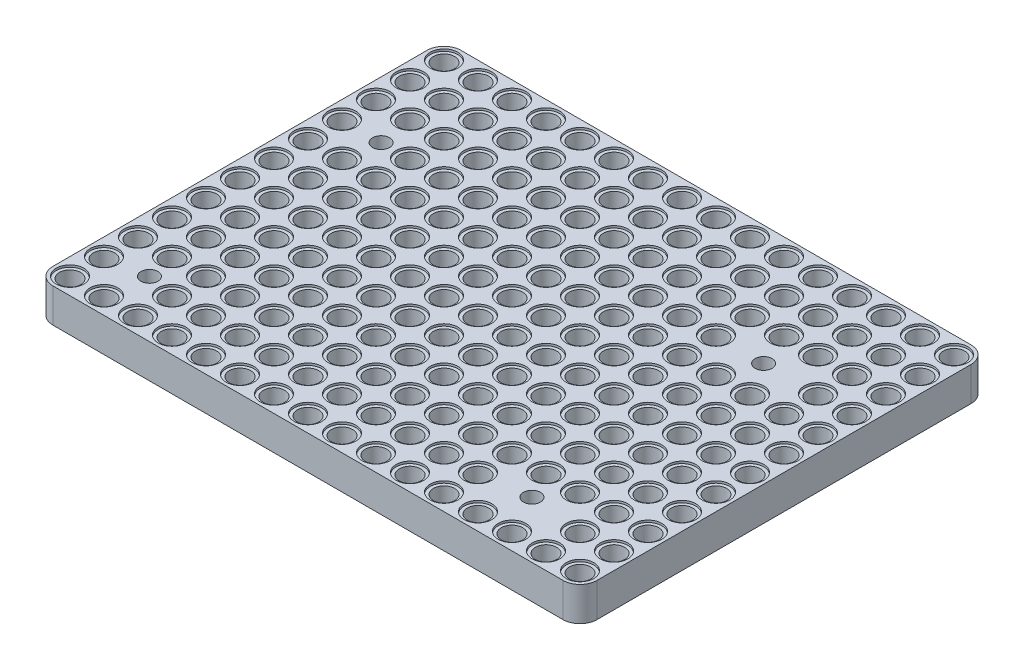
from build123d import *

# Parameters (mm, degrees)
SKETCH_1_R          = 2.5
SKETCH_1_R_2        = 2
EXTRUDE_1_DEPTH     = 8
SKETCH_2_R          = 3.25
CUT_EXTRUDE_1_DEPTH = 0.5
CUT_EXTRUDE_START   = -0.5
SKETCH_3_R          = 3.25
CUT_EXTRUDE_2_DEPTH = 0.5


with BuildPart() as part:
    # Эскиз1 → Бобышка-Вытянуть1 (new body)
    with BuildSketch(Plane(origin=(0, 0, 0), x_dir=(1, 0, 0), z_dir=(0, 1, 0))):
        with BuildLine():
            Line((-9.4, -13.3), (110.6, -13.3))
            ThreePointArc((110.6, -13.3), (113.428427125, -12.128427125), (114.6, -9.3))
            Line((114.6, -9.3), (114.6, 78.7))
            ThreePointArc((114.6, 78.7), (113.428427125, 81.528427125), (110.6, 82.7))
            Line((110.6, 82.7), (-9.4, 82.7))
            ThreePointArc((-9.4, 82.7), (-12.228427125, 81.528427125), (-13.4, 78.7))
            Line((-13.4, 78.7), (-13.4, -9.3))
            ThreePointArc((-13.4, -9.3), (-12.228427125, -12.128427125), (-9.4, -13.3))
        make_face()
        with Locations(Location((-9.4, 78.7, 0), (0, 0, 270))):
            Circle(SKETCH_1_R, mode=Mode.SUBTRACT)
        with Locations(Location((-1.4, 78.7, 0), (0, 0, 270))):
            Circle(SKETCH_1_R, mode=Mode.SUBTRACT)
        with Locations(Location((6.6, 78.7, 0), (0, 0, 270))):
            Circle(SKETCH_1_R, mode=Mode.SUBTRACT)
        with Locations(Location((14.6, 78.7, 0), (0, 0, 270))):
            Circle(SKETCH_1_R, mode=Mode.SUBTRACT)
        with Locations(Location((22.6, 78.7, 0), (0, 0, 270))):
            Circle(SKETCH_1_R, mode=Mode.SUBTRACT)
        with Locations(Location((30.6, 78.7, 0), (0, 0, 270))):
            Circle(SKETCH_1_R, mode=Mode.SUBTRACT)
        with Locations(Location((38.6, 78.7, 0), (0, 0, 270))):
            Circle(SKETCH_1_R, mode=Mode.SUBTRACT)
        with Locations(Location((46.6, 78.7, 0), (0, 0, 270))):
            Circle(SKETCH_1_R, mode=Mode.SUBTRACT)
        with Locations(Location((54.6, 78.7, 0), (0, 0, 270))):
            Circle(SKETCH_1_R, mode=Mode.SUBTRACT)
        with Locations(Location((62.6, 78.7, 0), (0, 0, 270))):
            Circle(SKETCH_1_R, mode=Mode.SUBTRACT)
        with Locations(Location((70.6, 78.7, 0), (0, 0, 270))):
            Circle(SKETCH_1_R, mode=Mode.SUBTRACT)
        with Locations(Location((78.6, 78.7, 0), (0, 0, 270))):
            Circle(SKETCH_1_R, mode=Mode.SUBTRACT)
        with Locations(Location((86.6, 78.7, 0), (0, 0, 270))):
            Circle(SKETCH_1_R, mode=Mode.SUBTRACT)
        with Locations(Location((94.6, 78.7, 0), (0, 0, 270))):
            Circle(SKETCH_1_R, mode=Mode.SUBTRACT)
        with Locations(Location((102.6, 78.7, 0), (0, 0, 270))):
            Circle(SKETCH_1_R, mode=Mode.SUBTRACT)
        with Locations(Location((110.6, 78.7, 0), (0, 0, 270))):
            Circle(SKETCH_1_R, mode=Mode.SUBTRACT)
        with Locations(Location((-1.4, 70.7, 0), (0, 0, 270))):
            Circle(SKETCH_1_R, mode=Mode.SUBTRACT)
        with Locations(Location((6.6, 70.7, 0), (0, 0, 270))):
            Circle(SKETCH_1_R, mode=Mode.SUBTRACT)
        with Locations(Location((14.6, 70.7, 0), (0, 0, 270))):
            Circle(SKETCH_1_R, mode=Mode.SUBTRACT)
        with Locations(Location((22.6, 70.7, 0), (0, 0, 270))):
            Circle(SKETCH_1_R, mode=Mode.SUBTRACT)
        with Locations(Location((30.6, 70.7, 0), (0, 0, 270))):
            Circle(SKETCH_1_R, mode=Mode.SUBTRACT)
        with Locations(Location((38.6, 70.7, 0), (0, 0, 270))):
            Circle(SKETCH_1_R, mode=Mode.SUBTRACT)
        with Locations(Location((46.6, 70.7, 0), (0, 0, 270))):
            Circle(SKETCH_1_R, mode=Mode.SUBTRACT)
        with Locations(Location((54.6, 70.7, 0), (0, 0, 270))):
            Circle(SKETCH_1_R, mode=Mode.SUBTRACT)
        with Locations(Location((62.6, 70.7, 0), (0, 0, 270))):
            Circle(SKETCH_1_R, mode=Mode.SUBTRACT)
        with Locations(Location((70.6, 70.7, 0), (0, 0, 270))):
            Circle(SKETCH_1_R, mode=Mode.SUBTRACT)
        with Locations(Location((78.6, 70.7, 0), (0, 0, 270))):
            Circle(SKETCH_1_R, mode=Mode.SUBTRACT)
        with Locations(Location((86.6, 70.7, 0), (0, 0, 270))):
            Circle(SKETCH_1_R, mode=Mode.SUBTRACT)
        with Locations(Location((94.6, 70.7, 0), (0, 0, 270))):
            Circle(SKETCH_1_R, mode=Mode.SUBTRACT)
        with Locations(Location((102.6, 70.7, 0), (0, 0, 270))):
            Circle(SKETCH_1_R, mode=Mode.SUBTRACT)
        with Locations(Location((110.6, 70.7, 0), (0, 0, 270))):
            Circle(SKETCH_1_R, mode=Mode.SUBTRACT)
        with Locations(Location((-1.4, 62.7, 0), (0, 0, 270))):
            Circle(SKETCH_1_R, mode=Mode.SUBTRACT)
        with Locations(Location((6.6, 62.7, 0), (0, 0, 270))):
            Circle(SKETCH_1_R, mode=Mode.SUBTRACT)
        with Locations(Location((14.6, 62.7, 0), (0, 0, 270))):
            Circle(SKETCH_1_R, mode=Mode.SUBTRACT)
        with Locations(Location((22.6, 62.7, 0), (0, 0, 270))):
            Circle(SKETCH_1_R, mode=Mode.SUBTRACT)
        with Locations(Location((30.6, 62.7, 0), (0, 0, 270))):
            Circle(SKETCH_1_R, mode=Mode.SUBTRACT)
        with Locations(Location((38.6, 62.7, 0), (0, 0, 270))):
            Circle(SKETCH_1_R, mode=Mode.SUBTRACT)
        with Locations(Location((46.6, 62.7, 0), (0, 0, 270))):
            Circle(SKETCH_1_R, mode=Mode.SUBTRACT)
        with Locations(Location((54.6, 62.7, 0), (0, 0, 270))):
            Circle(SKETCH_1_R, mode=Mode.SUBTRACT)
        with Locations(Location((62.6, 62.7, 0), (0, 0, 270))):
            Circle(SKETCH_1_R, mode=Mode.SUBTRACT)
        with Locations(Location((70.6, 62.7, 0), (0, 0, 270))):
            Circle(SKETCH_1_R, mode=Mode.SUBTRACT)
        with Locations(Location((78.6, 62.7, 0), (0, 0, 270))):
            Circle(SKETCH_1_R, mode=Mode.SUBTRACT)
        with Locations(Location((86.6, 62.7, 0), (0, 0, 270))):
            Circle(SKETCH_1_R, mode=Mode.SUBTRACT)
        with Locations(Location((94.6, 62.7, 0), (0, 0, 270))):
            Circle(SKETCH_1_R, mode=Mode.SUBTRACT)
        with Locations(Location((102.6, 62.7, 0), (0, 0, 270))):
            Circle(SKETCH_1_R, mode=Mode.SUBTRACT)
        with Locations(Location((110.6, 62.7, 0), (0, 0, 270))):
            Circle(SKETCH_1_R, mode=Mode.SUBTRACT)
        with Locations(Location((6.6, 54.7, 0), (0, 0, 270))):
            Circle(SKETCH_1_R, mode=Mode.SUBTRACT)
        with Locations(Location((14.6, 54.7, 0), (0, 0, 270))):
            Circle(SKETCH_1_R, mode=Mode.SUBTRACT)
        with Locations(Location((22.6, 54.7, 0), (0, 0, 270))):
            Circle(SKETCH_1_R, mode=Mode.SUBTRACT)
        with Locations(Location((30.6, 54.7, 0), (0, 0, 270))):
            Circle(SKETCH_1_R, mode=Mode.SUBTRACT)
        with Locations(Location((38.6, 54.7, 0), (0, 0, 270))):
            Circle(SKETCH_1_R, mode=Mode.SUBTRACT)
        with Locations(Location((46.6, 54.7, 0), (0, 0, 270))):
            Circle(SKETCH_1_R, mode=Mode.SUBTRACT)
        with Locations(Location((54.6, 54.7, 0), (0, 0, 270))):
            Circle(SKETCH_1_R, mode=Mode.SUBTRACT)
        with Locations(Location((62.6, 54.7, 0), (0, 0, 270))):
            Circle(SKETCH_1_R, mode=Mode.SUBTRACT)
        with Locations(Location((70.6, 54.7, 0), (0, 0, 270))):
            Circle(SKETCH_1_R, mode=Mode.SUBTRACT)
        with Locations(Location((78.6, 54.7, 0), (0, 0, 270))):
            Circle(SKETCH_1_R, mode=Mode.SUBTRACT)
        with Locations(Location((102.6, 54.7, 0), (0, 0, 270))):
            Circle(SKETCH_1_R, mode=Mode.SUBTRACT)
        with Locations(Location((110.6, 54.7, 0), (0, 0, 270))):
            Circle(SKETCH_1_R, mode=Mode.SUBTRACT)
        with Locations(Location((-1.4, 46.7, 0), (0, 0, 270))):
            Circle(SKETCH_1_R, mode=Mode.SUBTRACT)
        with Locations(Location((6.6, 46.7, 0), (0, 0, 270))):
            Circle(SKETCH_1_R, mode=Mode.SUBTRACT)
        with Locations(Location((14.6, 46.7, 0), (0, 0, 270))):
            Circle(SKETCH_1_R, mode=Mode.SUBTRACT)
        with Locations(Location((22.6, 46.7, 0), (0, 0, 270))):
            Circle(SKETCH_1_R, mode=Mode.SUBTRACT)
        with Locations(Location((30.6, 46.7, 0), (0, 0, 270))):
            Circle(SKETCH_1_R, mode=Mode.SUBTRACT)
        with Locations(Location((38.6, 46.7, 0), (0, 0, 270))):
            Circle(SKETCH_1_R, mode=Mode.SUBTRACT)
        with Locations(Location((46.6, 46.7, 0), (0, 0, 270))):
            Circle(SKETCH_1_R, mode=Mode.SUBTRACT)
        with Locations(Location((54.6, 46.7, 0), (0, 0, 270))):
            Circle(SKETCH_1_R, mode=Mode.SUBTRACT)
        with Locations(Location((62.6, 46.7, 0), (0, 0, 270))):
            Circle(SKETCH_1_R, mode=Mode.SUBTRACT)
        with Locations(Location((70.6, 46.7, 0), (0, 0, 270))):
            Circle(SKETCH_1_R, mode=Mode.SUBTRACT)
        with Locations(Location((78.6, 46.7, 0), (0, 0, 270))):
            Circle(SKETCH_1_R, mode=Mode.SUBTRACT)
        with Locations(Location((86.6, 46.7, 0), (0, 0, 270))):
            Circle(SKETCH_1_R, mode=Mode.SUBTRACT)
        with Locations(Location((94.6, 46.7, 0), (0, 0, 270))):
            Circle(SKETCH_1_R, mode=Mode.SUBTRACT)
        with Locations(Location((102.6, 46.7, 0), (0, 0, 270))):
            Circle(SKETCH_1_R, mode=Mode.SUBTRACT)
        with Locations(Location((110.6, 46.7, 0), (0, 0, 270))):
            Circle(SKETCH_1_R, mode=Mode.SUBTRACT)
        with Locations(Location((-1.4, 38.7, 0), (0, 0, 270))):
            Circle(SKETCH_1_R, mode=Mode.SUBTRACT)
        with Locations(Location((6.6, 38.7, 0), (0, 0, 270))):
            Circle(SKETCH_1_R, mode=Mode.SUBTRACT)
        with Locations(Location((14.6, 38.7, 0), (0, 0, 270))):
            Circle(SKETCH_1_R, mode=Mode.SUBTRACT)
        with Locations(Location((22.6, 38.7, 0), (0, 0, 270))):
            Circle(SKETCH_1_R, mode=Mode.SUBTRACT)
        with Locations(Location((30.6, 38.7, 0), (0, 0, 270))):
            Circle(SKETCH_1_R, mode=Mode.SUBTRACT)
        with Locations(Location((38.6, 38.7, 0), (0, 0, 270))):
            Circle(SKETCH_1_R, mode=Mode.SUBTRACT)
        with Locations(Location((46.6, 38.7, 0), (0, 0, 270))):
            Circle(SKETCH_1_R, mode=Mode.SUBTRACT)
        with Locations(Location((54.6, 38.7, 0), (0, 0, 270))):
            Circle(SKETCH_1_R, mode=Mode.SUBTRACT)
        with Locations(Location((62.6, 38.7, 0), (0, 0, 270))):
            Circle(SKETCH_1_R, mode=Mode.SUBTRACT)
        with Locations(Location((70.6, 38.7, 0), (0, 0, 270))):
            Circle(SKETCH_1_R, mode=Mode.SUBTRACT)
        with Locations(Location((78.6, 38.7, 0), (0, 0, 270))):
            Circle(SKETCH_1_R, mode=Mode.SUBTRACT)
        with Locations(Location((86.6, 38.7, 0), (0, 0, 270))):
            Circle(SKETCH_1_R, mode=Mode.SUBTRACT)
        with Locations(Location((94.6, 38.7, 0), (0, 0, 270))):
            Circle(SKETCH_1_R, mode=Mode.SUBTRACT)
        with Locations(Location((102.6, 38.7, 0), (0, 0, 270))):
            Circle(SKETCH_1_R, mode=Mode.SUBTRACT)
        with Locations(Location((110.6, 38.7, 0), (0, 0, 270))):
            Circle(SKETCH_1_R, mode=Mode.SUBTRACT)
        with Locations(Location((-1.4, 30.7, 0), (0, 0, 270))):
            Circle(SKETCH_1_R, mode=Mode.SUBTRACT)
        with Locations(Location((6.6, 30.7, 0), (0, 0, 270))):
            Circle(SKETCH_1_R, mode=Mode.SUBTRACT)
        with Locations(Location((14.6, 30.7, 0), (0, 0, 270))):
            Circle(SKETCH_1_R, mode=Mode.SUBTRACT)
        with Locations(Location((22.6, 30.7, 0), (0, 0, 270))):
            Circle(SKETCH_1_R, mode=Mode.SUBTRACT)
        with Locations(Location((30.6, 30.7, 0), (0, 0, 270))):
            Circle(SKETCH_1_R, mode=Mode.SUBTRACT)
        with Locations(Location((38.6, 30.7, 0), (0, 0, 270))):
            Circle(SKETCH_1_R, mode=Mode.SUBTRACT)
        with Locations(Location((46.6, 30.7, 0), (0, 0, 270))):
            Circle(SKETCH_1_R, mode=Mode.SUBTRACT)
        with Locations(Location((54.6, 30.7, 0), (0, 0, 270))):
            Circle(SKETCH_1_R, mode=Mode.SUBTRACT)
        with Locations(Location((62.6, 30.7, 0), (0, 0, 270))):
            Circle(SKETCH_1_R, mode=Mode.SUBTRACT)
        with Locations(Location((70.6, 30.7, 0), (0, 0, 270))):
            Circle(SKETCH_1_R, mode=Mode.SUBTRACT)
        with Locations(Location((78.6, 30.7, 0), (0, 0, 270))):
            Circle(SKETCH_1_R, mode=Mode.SUBTRACT)
        with Locations(Location((86.6, 30.7, 0), (0, 0, 270))):
            Circle(SKETCH_1_R, mode=Mode.SUBTRACT)
        with Locations(Location((94.6, 30.7, 0), (0, 0, 270))):
            Circle(SKETCH_1_R, mode=Mode.SUBTRACT)
        with Locations(Location((102.6, 30.7, 0), (0, 0, 270))):
            Circle(SKETCH_1_R, mode=Mode.SUBTRACT)
        with Locations(Location((110.6, 30.7, 0), (0, 0, 270))):
            Circle(SKETCH_1_R, mode=Mode.SUBTRACT)
        with Locations(Location((-1.4, 22.7, 0), (0, 0, 270))):
            Circle(SKETCH_1_R, mode=Mode.SUBTRACT)
        with Locations(Location((6.6, 22.7, 0), (0, 0, 270))):
            Circle(SKETCH_1_R, mode=Mode.SUBTRACT)
        with Locations(Location((14.6, 22.7, 0), (0, 0, 270))):
            Circle(SKETCH_1_R, mode=Mode.SUBTRACT)
        with Locations(Location((22.6, 22.7, 0), (0, 0, 270))):
            Circle(SKETCH_1_R, mode=Mode.SUBTRACT)
        with Locations(Location((30.6, 22.7, 0), (0, 0, 270))):
            Circle(SKETCH_1_R, mode=Mode.SUBTRACT)
        with Locations(Location((38.6, 22.7, 0), (0, 0, 270))):
            Circle(SKETCH_1_R, mode=Mode.SUBTRACT)
        with Locations(Location((46.6, 22.7, 0), (0, 0, 270))):
            Circle(SKETCH_1_R, mode=Mode.SUBTRACT)
        with Locations(Location((54.6, 22.7, 0), (0, 0, 270))):
            Circle(SKETCH_1_R, mode=Mode.SUBTRACT)
        with Locations(Location((62.6, 22.7, 0), (0, 0, 270))):
            Circle(SKETCH_1_R, mode=Mode.SUBTRACT)
        with Locations(Location((70.6, 22.7, 0), (0, 0, 270))):
            Circle(SKETCH_1_R, mode=Mode.SUBTRACT)
        with Locations(Location((78.6, 22.7, 0), (0, 0, 270))):
            Circle(SKETCH_1_R, mode=Mode.SUBTRACT)
        with Locations(Location((86.6, 22.7, 0), (0, 0, 270))):
            Circle(SKETCH_1_R, mode=Mode.SUBTRACT)
        with Locations(Location((94.6, 22.7, 0), (0, 0, 270))):
            Circle(SKETCH_1_R, mode=Mode.SUBTRACT)
        with Locations(Location((102.6, 22.7, 0), (0, 0, 270))):
            Circle(SKETCH_1_R, mode=Mode.SUBTRACT)
        with Locations(Location((110.6, 22.7, 0), (0, 0, 270))):
            Circle(SKETCH_1_R, mode=Mode.SUBTRACT)
        with Locations(Location((-1.4, 14.7, 0), (0, 0, 270))):
            Circle(SKETCH_1_R, mode=Mode.SUBTRACT)
        with Locations(Location((6.6, 14.7, 0), (0, 0, 270))):
            Circle(SKETCH_1_R, mode=Mode.SUBTRACT)
        with Locations(Location((14.6, 14.7, 0), (0, 0, 270))):
            Circle(SKETCH_1_R, mode=Mode.SUBTRACT)
        with Locations(Location((22.6, 14.7, 0), (0, 0, 270))):
            Circle(SKETCH_1_R, mode=Mode.SUBTRACT)
        with Locations(Location((30.6, 14.7, 0), (0, 0, 270))):
            Circle(SKETCH_1_R, mode=Mode.SUBTRACT)
        with Locations(Location((38.6, 14.7, 0), (0, 0, 270))):
            Circle(SKETCH_1_R, mode=Mode.SUBTRACT)
        with Locations(Location((46.6, 14.7, 0), (0, 0, 270))):
            Circle(SKETCH_1_R, mode=Mode.SUBTRACT)
        with Locations(Location((54.6, 14.7, 0), (0, 0, 270))):
            Circle(SKETCH_1_R, mode=Mode.SUBTRACT)
        with Locations(Location((62.6, 14.7, 0), (0, 0, 270))):
            Circle(SKETCH_1_R, mode=Mode.SUBTRACT)
        with Locations(Location((70.6, 14.7, 0), (0, 0, 270))):
            Circle(SKETCH_1_R, mode=Mode.SUBTRACT)
        with Locations(Location((78.6, 14.7, 0), (0, 0, 270))):
            Circle(SKETCH_1_R, mode=Mode.SUBTRACT)
        with Locations(Location((86.6, 14.7, 0), (0, 0, 270))):
            Circle(SKETCH_1_R, mode=Mode.SUBTRACT)
        with Locations(Location((94.6, 14.7, 0), (0, 0, 270))):
            Circle(SKETCH_1_R, mode=Mode.SUBTRACT)
        with Locations(Location((102.6, 14.7, 0), (0, 0, 270))):
            Circle(SKETCH_1_R, mode=Mode.SUBTRACT)
        with Locations(Location((110.6, 14.7, 0), (0, 0, 270))):
            Circle(SKETCH_1_R, mode=Mode.SUBTRACT)
        with Locations(Location((-1.4, 6.7, 0), (0, 0, 270))):
            Circle(SKETCH_1_R, mode=Mode.SUBTRACT)
        with Locations(Location((6.6, 6.7, 0), (0, 0, 270))):
            Circle(SKETCH_1_R, mode=Mode.SUBTRACT)
        with Locations(Location((14.6, 6.7, 0), (0, 0, 270))):
            Circle(SKETCH_1_R, mode=Mode.SUBTRACT)
        with Locations(Location((22.6, 6.7, 0), (0, 0, 270))):
            Circle(SKETCH_1_R, mode=Mode.SUBTRACT)
        with Locations(Location((30.6, 6.7, 0), (0, 0, 270))):
            Circle(SKETCH_1_R, mode=Mode.SUBTRACT)
        with Locations(Location((38.6, 6.7, 0), (0, 0, 270))):
            Circle(SKETCH_1_R, mode=Mode.SUBTRACT)
        with Locations(Location((46.6, 6.7, 0), (0, 0, 270))):
            Circle(SKETCH_1_R, mode=Mode.SUBTRACT)
        with Locations(Location((54.6, 6.7, 0), (0, 0, 270))):
            Circle(SKETCH_1_R, mode=Mode.SUBTRACT)
        with Locations(Location((62.6, 6.7, 0), (0, 0, 270))):
            Circle(SKETCH_1_R, mode=Mode.SUBTRACT)
        with Locations(Location((70.6, 6.7, 0), (0, 0, 270))):
            Circle(SKETCH_1_R, mode=Mode.SUBTRACT)
        with Locations(Location((78.6, 6.7, 0), (0, 0, 270))):
            Circle(SKETCH_1_R, mode=Mode.SUBTRACT)
        with Locations(Location((86.6, 6.7, 0), (0, 0, 270))):
            Circle(SKETCH_1_R, mode=Mode.SUBTRACT)
        with Locations(Location((94.6, 6.7, 0), (0, 0, 270))):
            Circle(SKETCH_1_R, mode=Mode.SUBTRACT)
        with Locations(Location((102.6, 6.7, 0), (0, 0, 270))):
            Circle(SKETCH_1_R, mode=Mode.SUBTRACT)
        with Locations(Location((110.6, 6.7, 0), (0, 0, 270))):
            Circle(SKETCH_1_R, mode=Mode.SUBTRACT)
        with Locations(Location((6.6, -1.3, 0), (0, 0, 270))):
            Circle(SKETCH_1_R, mode=Mode.SUBTRACT)
        with Locations(Location((14.6, -1.3, 0), (0, 0, 270))):
            Circle(SKETCH_1_R, mode=Mode.SUBTRACT)
        with Locations(Location((22.6, -1.3, 0), (0, 0, 270))):
            Circle(SKETCH_1_R, mode=Mode.SUBTRACT)
        with Locations(Location((30.6, -1.3, 0), (0, 0, 270))):
            Circle(SKETCH_1_R, mode=Mode.SUBTRACT)
        with Locations(Location((38.6, -1.3, 0), (0, 0, 270))):
            Circle(SKETCH_1_R, mode=Mode.SUBTRACT)
        with Locations(Location((46.6, -1.3, 0), (0, 0, 270))):
            Circle(SKETCH_1_R, mode=Mode.SUBTRACT)
        with Locations(Location((54.6, -1.3, 0), (0, 0, 270))):
            Circle(SKETCH_1_R, mode=Mode.SUBTRACT)
        with Locations(Location((62.6, -1.3, 0), (0, 0, 270))):
            Circle(SKETCH_1_R, mode=Mode.SUBTRACT)
        with Locations(Location((70.6, -1.3, 0), (0, 0, 270))):
            Circle(SKETCH_1_R, mode=Mode.SUBTRACT)
        with Locations(Location((78.6, -1.3, 0), (0, 0, 270))):
            Circle(SKETCH_1_R, mode=Mode.SUBTRACT)
        with Locations(Location((102.6, -1.3, 0), (0, 0, 270))):
            Circle(SKETCH_1_R, mode=Mode.SUBTRACT)
        with Locations(Location((110.6, -1.3, 0), (0, 0, 270))):
            Circle(SKETCH_1_R, mode=Mode.SUBTRACT)
        with Locations(Location((-1.4, -9.3, 0), (0, 0, 270))):
            Circle(SKETCH_1_R, mode=Mode.SUBTRACT)
        with Locations(Location((6.6, -9.3, 0), (0, 0, 270))):
            Circle(SKETCH_1_R, mode=Mode.SUBTRACT)
        with Locations(Location((14.6, -9.3, 0), (0, 0, 270))):
            Circle(SKETCH_1_R, mode=Mode.SUBTRACT)
        with Locations(Location((22.6, -9.3, 0), (0, 0, 270))):
            Circle(SKETCH_1_R, mode=Mode.SUBTRACT)
        with Locations(Location((30.6, -9.3, 0), (0, 0, 270))):
            Circle(SKETCH_1_R, mode=Mode.SUBTRACT)
        with Locations(Location((38.6, -9.3, 0), (0, 0, 270))):
            Circle(SKETCH_1_R, mode=Mode.SUBTRACT)
        with Locations(Location((46.6, -9.3, 0), (0, 0, 270))):
            Circle(SKETCH_1_R, mode=Mode.SUBTRACT)
        with Locations(Location((54.6, -9.3, 0), (0, 0, 270))):
            Circle(SKETCH_1_R, mode=Mode.SUBTRACT)
        with Locations(Location((62.6, -9.3, 0), (0, 0, 270))):
            Circle(SKETCH_1_R, mode=Mode.SUBTRACT)
        with Locations(Location((70.6, -9.3, 0), (0, 0, 270))):
            Circle(SKETCH_1_R, mode=Mode.SUBTRACT)
        with Locations(Location((78.6, -9.3, 0), (0, 0, 270))):
            Circle(SKETCH_1_R, mode=Mode.SUBTRACT)
        with Locations(Location((86.6, -9.3, 0), (0, 0, 270))):
            Circle(SKETCH_1_R, mode=Mode.SUBTRACT)
        with Locations(Location((94.6, -9.3, 0), (0, 0, 270))):
            Circle(SKETCH_1_R, mode=Mode.SUBTRACT)
        with Locations(Location((102.6, -9.3, 0), (0, 0, 270))):
            Circle(SKETCH_1_R, mode=Mode.SUBTRACT)
        with Locations(Location((110.6, -9.3, 0), (0, 0, 270))):
            Circle(SKETCH_1_R, mode=Mode.SUBTRACT)
        with Locations(Location((-9.4, 70.7, 0), (0, 0, 270))):
            Circle(SKETCH_1_R, mode=Mode.SUBTRACT)
        with Locations(Location((-9.4, 62.7, 0), (0, 0, 270))):
            Circle(SKETCH_1_R, mode=Mode.SUBTRACT)
        with Locations(Location((-9.4, 54.7, 0), (0, 0, 270))):
            Circle(SKETCH_1_R, mode=Mode.SUBTRACT)
        with Locations(Location((-9.4, 46.7, 0), (0, 0, 270))):
            Circle(SKETCH_1_R, mode=Mode.SUBTRACT)
        with Locations(Location((-9.4, 38.7, 0), (0, 0, 270))):
            Circle(SKETCH_1_R, mode=Mode.SUBTRACT)
        with Locations(Location((-9.4, 30.7, 0), (0, 0, 270))):
            Circle(SKETCH_1_R, mode=Mode.SUBTRACT)
        with Locations(Location((-9.4, 22.7, 0), (0, 0, 270))):
            Circle(SKETCH_1_R, mode=Mode.SUBTRACT)
        with Locations(Location((-9.4, 14.7, 0), (0, 0, 270))):
            Circle(SKETCH_1_R, mode=Mode.SUBTRACT)
        with Locations(Location((-9.4, 6.7, 0), (0, 0, 270))):
            Circle(SKETCH_1_R, mode=Mode.SUBTRACT)
        with Locations(Location((-9.4, -1.3, 0), (0, 0, 270))):
            Circle(SKETCH_1_R, mode=Mode.SUBTRACT)
        with Locations(Location((-9.4, -9.3, 0), (0, 0, 270))):
            Circle(SKETCH_1_R, mode=Mode.SUBTRACT)
        with Locations(Location((0, 54.5, 0), (0, 0, 270))):
            Circle(SKETCH_1_R_2, mode=Mode.SUBTRACT)
        with Locations(Location((90, 54.5, 0), (0, 0, 270))):
            Circle(SKETCH_1_R_2, mode=Mode.SUBTRACT)
        with Locations(Location((90, 0, 0), (0, 0, 270))):
            Circle(SKETCH_1_R_2, mode=Mode.SUBTRACT)
        with Locations(Location((0, 0, 0), (0, 0, 270))):
            Circle(SKETCH_1_R_2, mode=Mode.SUBTRACT)
    extrude(amount=EXTRUDE_1_DEPTH)

    # Эскиз2 → Вырез-Вытянуть1 (cut)
    with BuildSketch(Plane(origin=(0, 8, 0), x_dir=(1, 0, 0), z_dir=(0, 1, 0))):
        with Locations(Location((-9.4, 78.7, 0), (0, 0, 270))):
            Circle(SKETCH_2_R)
        with Locations(Location((-1.4, 78.7, 0), (0, 0, 270))):
            Circle(SKETCH_2_R)
        with Locations(Location((6.6, 78.7, 0), (0, 0, 270))):
            Circle(SKETCH_2_R)
        with Locations(Location((14.6, 78.7, 0), (0, 0, 270))):
            Circle(SKETCH_2_R)
        with Locations(Location((22.6, 78.7, 0), (0, 0, 270))):
            Circle(SKETCH_2_R)
        with Locations(Location((30.6, 78.7, 0), (0, 0, 270))):
            Circle(SKETCH_2_R)
        with Locations(Location((38.6, 78.7, 0), (0, 0, 270))):
            Circle(SKETCH_2_R)
        with Locations(Location((46.6, 78.7, 0), (0, 0, 270))):
            Circle(SKETCH_2_R)
        with Locations(Location((54.6, 78.7, 0), (0, 0, 270))):
            Circle(SKETCH_2_R)
        with Locations(Location((62.6, 78.7, 0), (0, 0, 270))):
            Circle(SKETCH_2_R)
        with Locations(Location((70.6, 78.7, 0), (0, 0, 270))):
            Circle(SKETCH_2_R)
        with Locations(Location((78.6, 78.7, 0), (0, 0, 270))):
            Circle(SKETCH_2_R)
        with Locations(Location((86.6, 78.7, 0), (0, 0, 270))):
            Circle(SKETCH_2_R)
        with Locations(Location((94.6, 78.7, 0), (0, 0, 270))):
            Circle(SKETCH_2_R)
        with Locations(Location((102.6, 78.7, 0), (0, 0, 270))):
            Circle(SKETCH_2_R)
        with Locations(Location((110.6, 78.7, 0), (0, 0, 270))):
            Circle(SKETCH_2_R)
        with Locations(Location((-1.4, 70.7, 0), (0, 0, 270))):
            Circle(SKETCH_2_R)
        with Locations(Location((6.6, 70.7, 0), (0, 0, 270))):
            Circle(SKETCH_2_R)
        with Locations(Location((14.6, 70.7, 0), (0, 0, 270))):
            Circle(SKETCH_2_R)
        with Locations(Location((22.6, 70.7, 0), (0, 0, 270))):
            Circle(SKETCH_2_R)
        with Locations(Location((30.6, 70.7, 0), (0, 0, 270))):
            Circle(SKETCH_2_R)
        with Locations(Location((38.6, 70.7, 0), (0, 0, 270))):
            Circle(SKETCH_2_R)
        with Locations(Location((46.6, 70.7, 0), (0, 0, 270))):
            Circle(SKETCH_2_R)
        with Locations(Location((54.6, 70.7, 0), (0, 0, 270))):
            Circle(SKETCH_2_R)
        with Locations(Location((62.6, 70.7, 0), (0, 0, 270))):
            Circle(SKETCH_2_R)
        with Locations(Location((70.6, 70.7, 0), (0, 0, 270))):
            Circle(SKETCH_2_R)
        with Locations(Location((78.6, 70.7, 0), (0, 0, 270))):
            Circle(SKETCH_2_R)
        with Locations(Location((86.6, 70.7, 0), (0, 0, 270))):
            Circle(SKETCH_2_R)
        with Locations(Location((94.6, 70.7, 0), (0, 0, 270))):
            Circle(SKETCH_2_R)
        with Locations(Location((102.6, 70.7, 0), (0, 0, 270))):
            Circle(SKETCH_2_R)
        with Locations(Location((110.6, 70.7, 0), (0, 0, 270))):
            Circle(SKETCH_2_R)
        with Locations(Location((-1.4, 62.7, 0), (0, 0, 270))):
            Circle(SKETCH_2_R)
        with Locations(Location((6.6, 62.7, 0), (0, 0, 270))):
            Circle(SKETCH_2_R)
        with Locations(Location((14.6, 62.7, 0), (0, 0, 270))):
            Circle(SKETCH_2_R)
        with Locations(Location((22.6, 62.7, 0), (0, 0, 270))):
            Circle(SKETCH_2_R)
        with Locations(Location((30.6, 62.7, 0), (0, 0, 270))):
            Circle(SKETCH_2_R)
        with Locations(Location((38.6, 62.7, 0), (0, 0, 270))):
            Circle(SKETCH_2_R)
        with Locations(Location((46.6, 62.7, 0), (0, 0, 270))):
            Circle(SKETCH_2_R)
        with Locations(Location((54.6, 62.7, 0), (0, 0, 270))):
            Circle(SKETCH_2_R)
        with Locations(Location((62.6, 62.7, 0), (0, 0, 270))):
            Circle(SKETCH_2_R)
        with Locations(Location((70.6, 62.7, 0), (0, 0, 270))):
            Circle(SKETCH_2_R)
        with Locations(Location((78.6, 62.7, 0), (0, 0, 270))):
            Circle(SKETCH_2_R)
        with Locations(Location((86.6, 62.7, 0), (0, 0, 270))):
            Circle(SKETCH_2_R)
        with Locations(Location((94.6, 62.7, 0), (0, 0, 270))):
            Circle(SKETCH_2_R)
        with Locations(Location((102.6, 62.7, 0), (0, 0, 270))):
            Circle(SKETCH_2_R)
        with Locations(Location((110.6, 62.7, 0), (0, 0, 270))):
            Circle(SKETCH_2_R)
        with Locations(Location((6.6, 54.7, 0), (0, 0, 270))):
            Circle(SKETCH_2_R)
        with Locations(Location((14.6, 54.7, 0), (0, 0, 270))):
            Circle(SKETCH_2_R)
        with Locations(Location((22.6, 54.7, 0), (0, 0, 270))):
            Circle(SKETCH_2_R)
        with Locations(Location((30.6, 54.7, 0), (0, 0, 270))):
            Circle(SKETCH_2_R)
        with Locations(Location((38.6, 54.7, 0), (0, 0, 270))):
            Circle(SKETCH_2_R)
        with Locations(Location((46.6, 54.7, 0), (0, 0, 270))):
            Circle(SKETCH_2_R)
        with Locations(Location((54.6, 54.7, 0), (0, 0, 270))):
            Circle(SKETCH_2_R)
        with Locations(Location((62.6, 54.7, 0), (0, 0, 270))):
            Circle(SKETCH_2_R)
        with Locations(Location((70.6, 54.7, 0), (0, 0, 270))):
            Circle(SKETCH_2_R)
        with Locations(Location((78.6, 54.7, 0), (0, 0, 270))):
            Circle(SKETCH_2_R)
        with Locations(Location((102.6, 54.7, 0), (0, 0, 270))):
            Circle(SKETCH_2_R)
        with Locations(Location((110.6, 54.7, 0), (0, 0, 270))):
            Circle(SKETCH_2_R)
        with Locations(Location((-1.4, 46.7, 0), (0, 0, 270))):
            Circle(SKETCH_2_R)
        with Locations(Location((6.6, 46.7, 0), (0, 0, 270))):
            Circle(SKETCH_2_R)
        with Locations(Location((14.6, 46.7, 0), (0, 0, 270))):
            Circle(SKETCH_2_R)
        with Locations(Location((22.6, 46.7, 0), (0, 0, 270))):
            Circle(SKETCH_2_R)
        with Locations(Location((30.6, 46.7, 0), (0, 0, 270))):
            Circle(SKETCH_2_R)
        with Locations(Location((38.6, 46.7, 0), (0, 0, 270))):
            Circle(SKETCH_2_R)
        with Locations(Location((46.6, 46.7, 0), (0, 0, 270))):
            Circle(SKETCH_2_R)
        with Locations(Location((54.6, 46.7, 0), (0, 0, 270))):
            Circle(SKETCH_2_R)
        with Locations(Location((62.6, 46.7, 0), (0, 0, 270))):
            Circle(SKETCH_2_R)
        with Locations(Location((70.6, 46.7, 0), (0, 0, 270))):
            Circle(SKETCH_2_R)
        with Locations(Location((78.6, 46.7, 0), (0, 0, 270))):
            Circle(SKETCH_2_R)
        with Locations(Location((86.6, 46.7, 0), (0, 0, 270))):
            Circle(SKETCH_2_R)
        with Locations(Location((94.6, 46.7, 0), (0, 0, 270))):
            Circle(SKETCH_2_R)
        with Locations(Location((102.6, 46.7, 0), (0, 0, 270))):
            Circle(SKETCH_2_R)
        with Locations(Location((110.6, 46.7, 0), (0, 0, 270))):
            Circle(SKETCH_2_R)
        with Locations(Location((-1.4, 38.7, 0), (0, 0, 270))):
            Circle(SKETCH_2_R)
        with Locations(Location((6.6, 38.7, 0), (0, 0, 270))):
            Circle(SKETCH_2_R)
        with Locations(Location((14.6, 38.7, 0), (0, 0, 270))):
            Circle(SKETCH_2_R)
        with Locations(Location((22.6, 38.7, 0), (0, 0, 270))):
            Circle(SKETCH_2_R)
        with Locations(Location((30.6, 38.7, 0), (0, 0, 270))):
            Circle(SKETCH_2_R)
        with Locations(Location((38.6, 38.7, 0), (0, 0, 270))):
            Circle(SKETCH_2_R)
        with Locations(Location((46.6, 38.7, 0), (0, 0, 270))):
            Circle(SKETCH_2_R)
        with Locations(Location((54.6, 38.7, 0), (0, 0, 270))):
            Circle(SKETCH_2_R)
        with Locations(Location((62.6, 38.7, 0), (0, 0, 270))):
            Circle(SKETCH_2_R)
        with Locations(Location((70.6, 38.7, 0), (0, 0, 270))):
            Circle(SKETCH_2_R)
        with Locations(Location((78.6, 38.7, 0), (0, 0, 270))):
            Circle(SKETCH_2_R)
        with Locations(Location((86.6, 38.7, 0), (0, 0, 270))):
            Circle(SKETCH_2_R)
        with Locations(Location((94.6, 38.7, 0), (0, 0, 270))):
            Circle(SKETCH_2_R)
        with Locations(Location((102.6, 38.7, 0), (0, 0, 270))):
            Circle(SKETCH_2_R)
        with Locations(Location((110.6, 38.7, 0), (0, 0, 270))):
            Circle(SKETCH_2_R)
        with Locations(Location((-1.4, 30.7, 0), (0, 0, 270))):
            Circle(SKETCH_2_R)
        with Locations(Location((6.6, 30.7, 0), (0, 0, 270))):
            Circle(SKETCH_2_R)
        with Locations(Location((14.6, 30.7, 0), (0, 0, 270))):
            Circle(SKETCH_2_R)
        with Locations(Location((22.6, 30.7, 0), (0, 0, 270))):
            Circle(SKETCH_2_R)
        with Locations(Location((30.6, 30.7, 0), (0, 0, 270))):
            Circle(SKETCH_2_R)
        with Locations(Location((38.6, 30.7, 0), (0, 0, 270))):
            Circle(SKETCH_2_R)
        with Locations(Location((46.6, 30.7, 0), (0, 0, 270))):
            Circle(SKETCH_2_R)
        with Locations(Location((54.6, 30.7, 0), (0, 0, 270))):
            Circle(SKETCH_2_R)
        with Locations(Location((62.6, 30.7, 0), (0, 0, 270))):
            Circle(SKETCH_2_R)
        with Locations(Location((70.6, 30.7, 0), (0, 0, 270))):
            Circle(SKETCH_2_R)
        with Locations(Location((78.6, 30.7, 0), (0, 0, 270))):
            Circle(SKETCH_2_R)
        with Locations(Location((86.6, 30.7, 0), (0, 0, 270))):
            Circle(SKETCH_2_R)
        with Locations(Location((94.6, 30.7, 0), (0, 0, 270))):
            Circle(SKETCH_2_R)
        with Locations(Location((102.6, 30.7, 0), (0, 0, 270))):
            Circle(SKETCH_2_R)
        with Locations(Location((110.6, 30.7, 0), (0, 0, 270))):
            Circle(SKETCH_2_R)
        with Locations(Location((-1.4, 22.7, 0), (0, 0, 270))):
            Circle(SKETCH_2_R)
        with Locations(Location((6.6, 22.7, 0), (0, 0, 270))):
            Circle(SKETCH_2_R)
        with Locations(Location((14.6, 22.7, 0), (0, 0, 270))):
            Circle(SKETCH_2_R)
        with Locations(Location((22.6, 22.7, 0), (0, 0, 270))):
            Circle(SKETCH_2_R)
        with Locations(Location((30.6, 22.7, 0), (0, 0, 270))):
            Circle(SKETCH_2_R)
        with Locations(Location((38.6, 22.7, 0), (0, 0, 270))):
            Circle(SKETCH_2_R)
        with Locations(Location((46.6, 22.7, 0), (0, 0, 270))):
            Circle(SKETCH_2_R)
        with Locations(Location((54.6, 22.7, 0), (0, 0, 270))):
            Circle(SKETCH_2_R)
        with Locations(Location((62.6, 22.7, 0), (0, 0, 270))):
            Circle(SKETCH_2_R)
        with Locations(Location((70.6, 22.7, 0), (0, 0, 270))):
            Circle(SKETCH_2_R)
        with Locations(Location((78.6, 22.7, 0), (0, 0, 270))):
            Circle(SKETCH_2_R)
        with Locations(Location((86.6, 22.7, 0), (0, 0, 270))):
            Circle(SKETCH_2_R)
        with Locations(Location((94.6, 22.7, 0), (0, 0, 270))):
            Circle(SKETCH_2_R)
        with Locations(Location((102.6, 22.7, 0), (0, 0, 270))):
            Circle(SKETCH_2_R)
        with Locations(Location((110.6, 22.7, 0), (0, 0, 270))):
            Circle(SKETCH_2_R)
        with Locations(Location((-1.4, 14.7, 0), (0, 0, 270))):
            Circle(SKETCH_2_R)
        with Locations(Location((6.6, 14.7, 0), (0, 0, 270))):
            Circle(SKETCH_2_R)
        with Locations(Location((14.6, 14.7, 0), (0, 0, 270))):
            Circle(SKETCH_2_R)
        with Locations(Location((22.6, 14.7, 0), (0, 0, 270))):
            Circle(SKETCH_2_R)
        with Locations(Location((30.6, 14.7, 0), (0, 0, 270))):
            Circle(SKETCH_2_R)
        with Locations(Location((38.6, 14.7, 0), (0, 0, 270))):
            Circle(SKETCH_2_R)
        with Locations(Location((46.6, 14.7, 0), (0, 0, 270))):
            Circle(SKETCH_2_R)
        with Locations(Location((54.6, 14.7, 0), (0, 0, 270))):
            Circle(SKETCH_2_R)
        with Locations(Location((62.6, 14.7, 0), (0, 0, 270))):
            Circle(SKETCH_2_R)
        with Locations(Location((70.6, 14.7, 0), (0, 0, 270))):
            Circle(SKETCH_2_R)
        with Locations(Location((78.6, 14.7, 0), (0, 0, 270))):
            Circle(SKETCH_2_R)
        with Locations(Location((86.6, 14.7, 0), (0, 0, 270))):
            Circle(SKETCH_2_R)
        with Locations(Location((94.6, 14.7, 0), (0, 0, 270))):
            Circle(SKETCH_2_R)
        with Locations(Location((102.6, 14.7, 0), (0, 0, 270))):
            Circle(SKETCH_2_R)
        with Locations(Location((110.6, 14.7, 0), (0, 0, 270))):
            Circle(SKETCH_2_R)
        with Locations(Location((-1.4, 6.7, 0), (0, 0, 270))):
            Circle(SKETCH_2_R)
        with Locations(Location((6.6, 6.7, 0), (0, 0, 270))):
            Circle(SKETCH_2_R)
        with Locations(Location((14.6, 6.7, 0), (0, 0, 270))):
            Circle(SKETCH_2_R)
        with Locations(Location((22.6, 6.7, 0), (0, 0, 270))):
            Circle(SKETCH_2_R)
        with Locations(Location((30.6, 6.7, 0), (0, 0, 270))):
            Circle(SKETCH_2_R)
        with Locations(Location((38.6, 6.7, 0), (0, 0, 270))):
            Circle(SKETCH_2_R)
        with Locations(Location((46.6, 6.7, 0), (0, 0, 270))):
            Circle(SKETCH_2_R)
        with Locations(Location((54.6, 6.7, 0), (0, 0, 270))):
            Circle(SKETCH_2_R)
        with Locations(Location((62.6, 6.7, 0), (0, 0, 270))):
            Circle(SKETCH_2_R)
        with Locations(Location((70.6, 6.7, 0), (0, 0, 270))):
            Circle(SKETCH_2_R)
        with Locations(Location((78.6, 6.7, 0), (0, 0, 270))):
            Circle(SKETCH_2_R)
        with Locations(Location((86.6, 6.7, 0), (0, 0, 270))):
            Circle(SKETCH_2_R)
        with Locations(Location((94.6, 6.7, 0), (0, 0, 270))):
            Circle(SKETCH_2_R)
        with Locations(Location((102.6, 6.7, 0), (0, 0, 270))):
            Circle(SKETCH_2_R)
        with Locations(Location((110.6, 6.7, 0), (0, 0, 270))):
            Circle(SKETCH_2_R)
        with Locations(Location((6.6, -1.3, 0), (0, 0, 270))):
            Circle(SKETCH_2_R)
        with Locations(Location((14.6, -1.3, 0), (0, 0, 270))):
            Circle(SKETCH_2_R)
        with Locations(Location((22.6, -1.3, 0), (0, 0, 270))):
            Circle(SKETCH_2_R)
        with Locations(Location((30.6, -1.3, 0), (0, 0, 270))):
            Circle(SKETCH_2_R)
        with Locations(Location((38.6, -1.3, 0), (0, 0, 270))):
            Circle(SKETCH_2_R)
        with Locations(Location((46.6, -1.3, 0), (0, 0, 270))):
            Circle(SKETCH_2_R)
        with Locations(Location((54.6, -1.3, 0), (0, 0, 270))):
            Circle(SKETCH_2_R)
        with Locations(Location((62.6, -1.3, 0), (0, 0, 270))):
            Circle(SKETCH_2_R)
        with Locations(Location((70.6, -1.3, 0), (0, 0, 270))):
            Circle(SKETCH_2_R)
        with Locations(Location((78.6, -1.3, 0), (0, 0, 270))):
            Circle(SKETCH_2_R)
        with Locations(Location((102.6, -1.3, 0), (0, 0, 270))):
            Circle(SKETCH_2_R)
        with Locations(Location((110.6, -1.3, 0), (0, 0, 270))):
            Circle(SKETCH_2_R)
        with Locations(Location((-1.4, -9.3, 0), (0, 0, 270))):
            Circle(SKETCH_2_R)
        with Locations(Location((6.6, -9.3, 0), (0, 0, 270))):
            Circle(SKETCH_2_R)
        with Locations(Location((14.6, -9.3, 0), (0, 0, 270))):
            Circle(SKETCH_2_R)
        with Locations(Location((22.6, -9.3, 0), (0, 0, 270))):
            Circle(SKETCH_2_R)
        with Locations(Location((30.6, -9.3, 0), (0, 0, 270))):
            Circle(SKETCH_2_R)
        with Locations(Location((38.6, -9.3, 0), (0, 0, 270))):
            Circle(SKETCH_2_R)
        with Locations(Location((46.6, -9.3, 0), (0, 0, 270))):
            Circle(SKETCH_2_R)
        with Locations(Location((54.6, -9.3, 0), (0, 0, 270))):
            Circle(SKETCH_2_R)
        with Locations(Location((62.6, -9.3, 0), (0, 0, 270))):
            Circle(SKETCH_2_R)
        with Locations(Location((70.6, -9.3, 0), (0, 0, 270))):
            Circle(SKETCH_2_R)
        with Locations(Location((78.6, -9.3, 0), (0, 0, 270))):
            Circle(SKETCH_2_R)
        with Locations(Location((86.6, -9.3, 0), (0, 0, 270))):
            Circle(SKETCH_2_R)
        with Locations(Location((94.6, -9.3, 0), (0, 0, 270))):
            Circle(SKETCH_2_R)
        with Locations(Location((102.6, -9.3, 0), (0, 0, 270))):
            Circle(SKETCH_2_R)
        with Locations(Location((110.6, -9.3, 0), (0, 0, 270))):
            Circle(SKETCH_2_R)
        with Locations(Location((-9.4, 70.7, 0), (0, 0, 270))):
            Circle(SKETCH_2_R)
        with Locations(Location((-9.4, 62.7, 0), (0, 0, 270))):
            Circle(SKETCH_2_R)
        with Locations(Location((-9.4, 54.7, 0), (0, 0, 270))):
            Circle(SKETCH_2_R)
        with Locations(Location((-9.4, 46.7, 0), (0, 0, 270))):
            Circle(SKETCH_2_R)
        with Locations(Location((-9.4, 38.7, 0), (0, 0, 270))):
            Circle(SKETCH_2_R)
        with Locations(Location((-9.4, 30.7, 0), (0, 0, 270))):
            Circle(SKETCH_2_R)
        with Locations(Location((-9.4, 22.7, 0), (0, 0, 270))):
            Circle(SKETCH_2_R)
        with Locations(Location((-9.4, 14.7, 0), (0, 0, 270))):
            Circle(SKETCH_2_R)
        with Locations(Location((-9.4, 6.7, 0), (0, 0, 270))):
            Circle(SKETCH_2_R)
        with Locations(Location((-9.4, -1.3, 0), (0, 0, 270))):
            Circle(SKETCH_2_R)
        with Locations(Location((-9.4, -9.3, 0), (0, 0, 270))):
            Circle(SKETCH_2_R)
    extrude(amount=-CUT_EXTRUDE_1_DEPTH, mode=Mode.SUBTRACT)

    # Эскиз3 → Вырез-Вытянуть2 (cut)
    with BuildSketch(Plane.XZ.offset(CUT_EXTRUDE_START)):
        with Locations(Location((-9.4, -78.7, 0), (0, 0, 90))):
            Circle(SKETCH_3_R)
        with Locations(Location((-1.4, -78.7, 0), (0, 0, 90))):
            Circle(SKETCH_3_R)
        with Locations(Location((6.6, -78.7, 0), (0, 0, 90))):
            Circle(SKETCH_3_R)
        with Locations(Location((14.6, -78.7, 0), (0, 0, 90))):
            Circle(SKETCH_3_R)
        with Locations(Location((22.6, -78.7, 0), (0, 0, 90))):
            Circle(SKETCH_3_R)
        with Locations(Location((30.6, -78.7, 0), (0, 0, 90))):
            Circle(SKETCH_3_R)
        with Locations(Location((38.6, -78.7, 0), (0, 0, 90))):
            Circle(SKETCH_3_R)
        with Locations(Location((46.6, -78.7, 0), (0, 0, 90))):
            Circle(SKETCH_3_R)
        with Locations(Location((54.6, -78.7, 0), (0, 0, 90))):
            Circle(SKETCH_3_R)
        with Locations(Location((62.6, -78.7, 0), (0, 0, 90))):
            Circle(SKETCH_3_R)
        with Locations(Location((70.6, -78.7, 0), (0, 0, 90))):
            Circle(SKETCH_3_R)
        with Locations(Location((78.6, -78.7, 0), (0, 0, 90))):
            Circle(SKETCH_3_R)
        with Locations(Location((86.6, -78.7, 0), (0, 0, 90))):
            Circle(SKETCH_3_R)
        with Locations(Location((94.6, -78.7, 0), (0, 0, 90))):
            Circle(SKETCH_3_R)
        with Locations(Location((102.6, -78.7, 0), (0, 0, 90))):
            Circle(SKETCH_3_R)
        with Locations(Location((110.6, -78.7, 0), (0, 0, 90))):
            Circle(SKETCH_3_R)
        with Locations(Location((-1.4, -70.7, 0), (0, 0, 90))):
            Circle(SKETCH_3_R)
        with Locations(Location((6.6, -70.7, 0), (0, 0, 90))):
            Circle(SKETCH_3_R)
        with Locations(Location((14.6, -70.7, 0), (0, 0, 90))):
            Circle(SKETCH_3_R)
        with Locations(Location((22.6, -70.7, 0), (0, 0, 90))):
            Circle(SKETCH_3_R)
        with Locations(Location((30.6, -70.7, 0), (0, 0, 90))):
            Circle(SKETCH_3_R)
        with Locations(Location((38.6, -70.7, 0), (0, 0, 90))):
            Circle(SKETCH_3_R)
        with Locations(Location((46.6, -70.7, 0), (0, 0, 90))):
            Circle(SKETCH_3_R)
        with Locations(Location((54.6, -70.7, 0), (0, 0, 90))):
            Circle(SKETCH_3_R)
        with Locations(Location((62.6, -70.7, 0), (0, 0, 90))):
            Circle(SKETCH_3_R)
        with Locations(Location((70.6, -70.7, 0), (0, 0, 90))):
            Circle(SKETCH_3_R)
        with Locations(Location((78.6, -70.7, 0), (0, 0, 90))):
            Circle(SKETCH_3_R)
        with Locations(Location((86.6, -70.7, 0), (0, 0, 90))):
            Circle(SKETCH_3_R)
        with Locations(Location((94.6, -70.7, 0), (0, 0, 90))):
            Circle(SKETCH_3_R)
        with Locations(Location((102.6, -70.7, 0), (0, 0, 90))):
            Circle(SKETCH_3_R)
        with Locations(Location((110.6, -70.7, 0), (0, 0, 90))):
            Circle(SKETCH_3_R)
        with Locations(Location((-1.4, -62.7, 0), (0, 0, 90))):
            Circle(SKETCH_3_R)
        with Locations(Location((6.6, -62.7, 0), (0, 0, 90))):
            Circle(SKETCH_3_R)
        with Locations(Location((14.6, -62.7, 0), (0, 0, 90))):
            Circle(SKETCH_3_R)
        with Locations(Location((22.6, -62.7, 0), (0, 0, 90))):
            Circle(SKETCH_3_R)
        with Locations(Location((30.6, -62.7, 0), (0, 0, 90))):
            Circle(SKETCH_3_R)
        with Locations(Location((38.6, -62.7, 0), (0, 0, 90))):
            Circle(SKETCH_3_R)
        with Locations(Location((46.6, -62.7, 0), (0, 0, 90))):
            Circle(SKETCH_3_R)
        with Locations(Location((54.6, -62.7, 0), (0, 0, 90))):
            Circle(SKETCH_3_R)
        with Locations(Location((62.6, -62.7, 0), (0, 0, 90))):
            Circle(SKETCH_3_R)
        with Locations(Location((70.6, -62.7, 0), (0, 0, 90))):
            Circle(SKETCH_3_R)
        with Locations(Location((78.6, -62.7, 0), (0, 0, 90))):
            Circle(SKETCH_3_R)
        with Locations(Location((86.6, -62.7, 0), (0, 0, 90))):
            Circle(SKETCH_3_R)
        with Locations(Location((94.6, -62.7, 0), (0, 0, 90))):
            Circle(SKETCH_3_R)
        with Locations(Location((102.6, -62.7, 0), (0, 0, 90))):
            Circle(SKETCH_3_R)
        with Locations(Location((110.6, -62.7, 0), (0, 0, 90))):
            Circle(SKETCH_3_R)
        with Locations(Location((6.6, -54.7, 0), (0, 0, 90))):
            Circle(SKETCH_3_R)
        with Locations(Location((14.6, -54.7, 0), (0, 0, 90))):
            Circle(SKETCH_3_R)
        with Locations(Location((22.6, -54.7, 0), (0, 0, 90))):
            Circle(SKETCH_3_R)
        with Locations(Location((30.6, -54.7, 0), (0, 0, 90))):
            Circle(SKETCH_3_R)
        with Locations(Location((38.6, -54.7, 0), (0, 0, 90))):
            Circle(SKETCH_3_R)
        with Locations(Location((46.6, -54.7, 0), (0, 0, 90))):
            Circle(SKETCH_3_R)
        with Locations(Location((54.6, -54.7, 0), (0, 0, 90))):
            Circle(SKETCH_3_R)
        with Locations(Location((62.6, -54.7, 0), (0, 0, 90))):
            Circle(SKETCH_3_R)
        with Locations(Location((70.6, -54.7, 0), (0, 0, 90))):
            Circle(SKETCH_3_R)
        with Locations(Location((78.6, -54.7, 0), (0, 0, 90))):
            Circle(SKETCH_3_R)
        with Locations(Location((102.6, -54.7, 0), (0, 0, 90))):
            Circle(SKETCH_3_R)
        with Locations(Location((110.6, -54.7, 0), (0, 0, 90))):
            Circle(SKETCH_3_R)
        with Locations(Location((-1.4, -46.7, 0), (0, 0, 90))):
            Circle(SKETCH_3_R)
        with Locations(Location((6.6, -46.7, 0), (0, 0, 90))):
            Circle(SKETCH_3_R)
        with Locations(Location((14.6, -46.7, 0), (0, 0, 90))):
            Circle(SKETCH_3_R)
        with Locations(Location((22.6, -46.7, 0), (0, 0, 90))):
            Circle(SKETCH_3_R)
        with Locations(Location((30.6, -46.7, 0), (0, 0, 90))):
            Circle(SKETCH_3_R)
        with Locations(Location((38.6, -46.7, 0), (0, 0, 90))):
            Circle(SKETCH_3_R)
        with Locations(Location((46.6, -46.7, 0), (0, 0, 90))):
            Circle(SKETCH_3_R)
        with Locations(Location((54.6, -46.7, 0), (0, 0, 90))):
            Circle(SKETCH_3_R)
        with Locations(Location((62.6, -46.7, 0), (0, 0, 90))):
            Circle(SKETCH_3_R)
        with Locations(Location((70.6, -46.7, 0), (0, 0, 90))):
            Circle(SKETCH_3_R)
        with Locations(Location((78.6, -46.7, 0), (0, 0, 90))):
            Circle(SKETCH_3_R)
        with Locations(Location((86.6, -46.7, 0), (0, 0, 90))):
            Circle(SKETCH_3_R)
        with Locations(Location((94.6, -46.7, 0), (0, 0, 90))):
            Circle(SKETCH_3_R)
        with Locations(Location((102.6, -46.7, 0), (0, 0, 90))):
            Circle(SKETCH_3_R)
        with Locations(Location((110.6, -46.7, 0), (0, 0, 90))):
            Circle(SKETCH_3_R)
        with Locations(Location((-1.4, -38.7, 0), (0, 0, 90))):
            Circle(SKETCH_3_R)
        with Locations(Location((6.6, -38.7, 0), (0, 0, 90))):
            Circle(SKETCH_3_R)
        with Locations(Location((14.6, -38.7, 0), (0, 0, 90))):
            Circle(SKETCH_3_R)
        with Locations(Location((22.6, -38.7, 0), (0, 0, 90))):
            Circle(SKETCH_3_R)
        with Locations(Location((30.6, -38.7, 0), (0, 0, 90))):
            Circle(SKETCH_3_R)
        with Locations(Location((38.6, -38.7, 0), (0, 0, 90))):
            Circle(SKETCH_3_R)
        with Locations(Location((46.6, -38.7, 0), (0, 0, 90))):
            Circle(SKETCH_3_R)
        with Locations(Location((54.6, -38.7, 0), (0, 0, 90))):
            Circle(SKETCH_3_R)
        with Locations(Location((62.6, -38.7, 0), (0, 0, 90))):
            Circle(SKETCH_3_R)
        with Locations(Location((70.6, -38.7, 0), (0, 0, 90))):
            Circle(SKETCH_3_R)
        with Locations(Location((78.6, -38.7, 0), (0, 0, 90))):
            Circle(SKETCH_3_R)
        with Locations(Location((86.6, -38.7, 0), (0, 0, 90))):
            Circle(SKETCH_3_R)
        with Locations(Location((94.6, -38.7, 0), (0, 0, 90))):
            Circle(SKETCH_3_R)
        with Locations(Location((102.6, -38.7, 0), (0, 0, 90))):
            Circle(SKETCH_3_R)
        with Locations(Location((110.6, -38.7, 0), (0, 0, 90))):
            Circle(SKETCH_3_R)
        with Locations(Location((-1.4, -30.7, 0), (0, 0, 90))):
            Circle(SKETCH_3_R)
        with Locations(Location((6.6, -30.7, 0), (0, 0, 90))):
            Circle(SKETCH_3_R)
        with Locations(Location((14.6, -30.7, 0), (0, 0, 90))):
            Circle(SKETCH_3_R)
        with Locations(Location((22.6, -30.7, 0), (0, 0, 90))):
            Circle(SKETCH_3_R)
        with Locations(Location((30.6, -30.7, 0), (0, 0, 90))):
            Circle(SKETCH_3_R)
        with Locations(Location((38.6, -30.7, 0), (0, 0, 90))):
            Circle(SKETCH_3_R)
        with Locations(Location((46.6, -30.7, 0), (0, 0, 90))):
            Circle(SKETCH_3_R)
        with Locations(Location((54.6, -30.7, 0), (0, 0, 90))):
            Circle(SKETCH_3_R)
        with Locations(Location((62.6, -30.7, 0), (0, 0, 90))):
            Circle(SKETCH_3_R)
        with Locations(Location((70.6, -30.7, 0), (0, 0, 90))):
            Circle(SKETCH_3_R)
        with Locations(Location((78.6, -30.7, 0), (0, 0, 90))):
            Circle(SKETCH_3_R)
        with Locations(Location((86.6, -30.7, 0), (0, 0, 90))):
            Circle(SKETCH_3_R)
        with Locations(Location((94.6, -30.7, 0), (0, 0, 90))):
            Circle(SKETCH_3_R)
        with Locations(Location((102.6, -30.7, 0), (0, 0, 90))):
            Circle(SKETCH_3_R)
        with Locations(Location((110.6, -30.7, 0), (0, 0, 90))):
            Circle(SKETCH_3_R)
        with Locations(Location((-1.4, -22.7, 0), (0, 0, 90))):
            Circle(SKETCH_3_R)
        with Locations(Location((6.6, -22.7, 0), (0, 0, 90))):
            Circle(SKETCH_3_R)
        with Locations(Location((14.6, -22.7, 0), (0, 0, 90))):
            Circle(SKETCH_3_R)
        with Locations(Location((22.6, -22.7, 0), (0, 0, 90))):
            Circle(SKETCH_3_R)
        with Locations(Location((30.6, -22.7, 0), (0, 0, 90))):
            Circle(SKETCH_3_R)
        with Locations(Location((38.6, -22.7, 0), (0, 0, 90))):
            Circle(SKETCH_3_R)
        with Locations(Location((46.6, -22.7, 0), (0, 0, 90))):
            Circle(SKETCH_3_R)
        with Locations(Location((54.6, -22.7, 0), (0, 0, 90))):
            Circle(SKETCH_3_R)
        with Locations(Location((62.6, -22.7, 0), (0, 0, 90))):
            Circle(SKETCH_3_R)
        with Locations(Location((70.6, -22.7, 0), (0, 0, 90))):
            Circle(SKETCH_3_R)
        with Locations(Location((78.6, -22.7, 0), (0, 0, 90))):
            Circle(SKETCH_3_R)
        with Locations(Location((86.6, -22.7, 0), (0, 0, 90))):
            Circle(SKETCH_3_R)
        with Locations(Location((94.6, -22.7, 0), (0, 0, 90))):
            Circle(SKETCH_3_R)
        with Locations(Location((102.6, -22.7, 0), (0, 0, 90))):
            Circle(SKETCH_3_R)
        with Locations(Location((110.6, -22.7, 0), (0, 0, 90))):
            Circle(SKETCH_3_R)
        with Locations(Location((-1.4, -14.7, 0), (0, 0, 90))):
            Circle(SKETCH_3_R)
        with Locations(Location((6.6, -14.7, 0), (0, 0, 90))):
            Circle(SKETCH_3_R)
        with Locations(Location((14.6, -14.7, 0), (0, 0, 90))):
            Circle(SKETCH_3_R)
        with Locations(Location((22.6, -14.7, 0), (0, 0, 90))):
            Circle(SKETCH_3_R)
        with Locations(Location((30.6, -14.7, 0), (0, 0, 90))):
            Circle(SKETCH_3_R)
        with Locations(Location((38.6, -14.7, 0), (0, 0, 90))):
            Circle(SKETCH_3_R)
        with Locations(Location((46.6, -14.7, 0), (0, 0, 90))):
            Circle(SKETCH_3_R)
        with Locations(Location((54.6, -14.7, 0), (0, 0, 90))):
            Circle(SKETCH_3_R)
        with Locations(Location((62.6, -14.7, 0), (0, 0, 90))):
            Circle(SKETCH_3_R)
        with Locations(Location((70.6, -14.7, 0), (0, 0, 90))):
            Circle(SKETCH_3_R)
        with Locations(Location((78.6, -14.7, 0), (0, 0, 90))):
            Circle(SKETCH_3_R)
        with Locations(Location((86.6, -14.7, 0), (0, 0, 90))):
            Circle(SKETCH_3_R)
        with Locations(Location((94.6, -14.7, 0), (0, 0, 90))):
            Circle(SKETCH_3_R)
        with Locations(Location((102.6, -14.7, 0), (0, 0, 90))):
            Circle(SKETCH_3_R)
        with Locations(Location((110.6, -14.7, 0), (0, 0, 90))):
            Circle(SKETCH_3_R)
        with Locations(Location((-1.4, -6.7, 0), (0, 0, 90))):
            Circle(SKETCH_3_R)
        with Locations(Location((6.6, -6.7, 0), (0, 0, 90))):
            Circle(SKETCH_3_R)
        with Locations(Location((14.6, -6.7, 0), (0, 0, 90))):
            Circle(SKETCH_3_R)
        with Locations(Location((22.6, -6.7, 0), (0, 0, 90))):
            Circle(SKETCH_3_R)
        with Locations(Location((30.6, -6.7, 0), (0, 0, 90))):
            Circle(SKETCH_3_R)
        with Locations(Location((38.6, -6.7, 0), (0, 0, 90))):
            Circle(SKETCH_3_R)
        with Locations(Location((46.6, -6.7, 0), (0, 0, 90))):
            Circle(SKETCH_3_R)
        with Locations(Location((54.6, -6.7, 0), (0, 0, 90))):
            Circle(SKETCH_3_R)
        with Locations(Location((62.6, -6.7, 0), (0, 0, 90))):
            Circle(SKETCH_3_R)
        with Locations(Location((70.6, -6.7, 0), (0, 0, 90))):
            Circle(SKETCH_3_R)
        with Locations(Location((78.6, -6.7, 0), (0, 0, 90))):
            Circle(SKETCH_3_R)
        with Locations(Location((86.6, -6.7, 0), (0, 0, 90))):
            Circle(SKETCH_3_R)
        with Locations(Location((94.6, -6.7, 0), (0, 0, 90))):
            Circle(SKETCH_3_R)
        with Locations(Location((102.6, -6.7, 0), (0, 0, 90))):
            Circle(SKETCH_3_R)
        with Locations(Location((110.6, -6.7, 0), (0, 0, 90))):
            Circle(SKETCH_3_R)
        with Locations(Location((6.6, 1.3, 0), (0, 0, 90))):
            Circle(SKETCH_3_R)
        with Locations(Location((14.6, 1.3, 0), (0, 0, 90))):
            Circle(SKETCH_3_R)
        with Locations(Location((22.6, 1.3, 0), (0, 0, 90))):
            Circle(SKETCH_3_R)
        with Locations(Location((30.6, 1.3, 0), (0, 0, 90))):
            Circle(SKETCH_3_R)
        with Locations(Location((38.6, 1.3, 0), (0, 0, 90))):
            Circle(SKETCH_3_R)
        with Locations(Location((46.6, 1.3, 0), (0, 0, 90))):
            Circle(SKETCH_3_R)
        with Locations(Location((54.6, 1.3, 0), (0, 0, 90))):
            Circle(SKETCH_3_R)
        with Locations(Location((62.6, 1.3, 0), (0, 0, 90))):
            Circle(SKETCH_3_R)
        with Locations(Location((70.6, 1.3, 0), (0, 0, 90))):
            Circle(SKETCH_3_R)
        with Locations(Location((78.6, 1.3, 0), (0, 0, 90))):
            Circle(SKETCH_3_R)
        with Locations(Location((102.6, 1.3, 0), (0, 0, 90))):
            Circle(SKETCH_3_R)
        with Locations(Location((110.6, 1.3, 0), (0, 0, 90))):
            Circle(SKETCH_3_R)
        with Locations(Location((-1.4, 9.3, 0), (0, 0, 90))):
            Circle(SKETCH_3_R)
        with Locations(Location((6.6, 9.3, 0), (0, 0, 90))):
            Circle(SKETCH_3_R)
        with Locations(Location((14.6, 9.3, 0), (0, 0, 90))):
            Circle(SKETCH_3_R)
        with Locations(Location((22.6, 9.3, 0), (0, 0, 90))):
            Circle(SKETCH_3_R)
        with Locations(Location((30.6, 9.3, 0), (0, 0, 90))):
            Circle(SKETCH_3_R)
        with Locations(Location((38.6, 9.3, 0), (0, 0, 90))):
            Circle(SKETCH_3_R)
        with Locations(Location((46.6, 9.3, 0), (0, 0, 90))):
            Circle(SKETCH_3_R)
        with Locations(Location((54.6, 9.3, 0), (0, 0, 90))):
            Circle(SKETCH_3_R)
        with Locations(Location((62.6, 9.3, 0), (0, 0, 90))):
            Circle(SKETCH_3_R)
        with Locations(Location((70.6, 9.3, 0), (0, 0, 90))):
            Circle(SKETCH_3_R)
        with Locations(Location((78.6, 9.3, 0), (0, 0, 90))):
            Circle(SKETCH_3_R)
        with Locations(Location((86.6, 9.3, 0), (0, 0, 90))):
            Circle(SKETCH_3_R)
        with Locations(Location((94.6, 9.3, 0), (0, 0, 90))):
            Circle(SKETCH_3_R)
        with Locations(Location((102.6, 9.3, 0), (0, 0, 90))):
            Circle(SKETCH_3_R)
        with Locations(Location((110.6, 9.3, 0), (0, 0, 90))):
            Circle(SKETCH_3_R)
        with Locations(Location((-9.4, -70.7, 0), (0, 0, 90))):
            Circle(SKETCH_3_R)
        with Locations(Location((-9.4, -62.7, 0), (0, 0, 90))):
            Circle(SKETCH_3_R)
        with Locations(Location((-9.4, -54.7, 0), (0, 0, 90))):
            Circle(SKETCH_3_R)
        with Locations(Location((-9.4, -46.7, 0), (0, 0, 90))):
            Circle(SKETCH_3_R)
        with Locations(Location((-9.4, -38.7, 0), (0, 0, 90))):
            Circle(SKETCH_3_R)
        with Locations(Location((-9.4, -30.7, 0), (0, 0, 90))):
            Circle(SKETCH_3_R)
        with Locations(Location((-9.4, -22.7, 0), (0, 0, 90))):
            Circle(SKETCH_3_R)
        with Locations(Location((-9.4, -14.7, 0), (0, 0, 90))):
            Circle(SKETCH_3_R)
        with Locations(Location((-9.4, -6.7, 0), (0, 0, 90))):
            Circle(SKETCH_3_R)
        with Locations(Location((-9.4, 1.3, 0), (0, 0, 90))):
            Circle(SKETCH_3_R)
        with Locations(Location((-9.4, 9.3, 0), (0, 0, 90))):
            Circle(SKETCH_3_R)
    extrude(amount=CUT_EXTRUDE_2_DEPTH, mode=Mode.SUBTRACT)


solid = part.part
